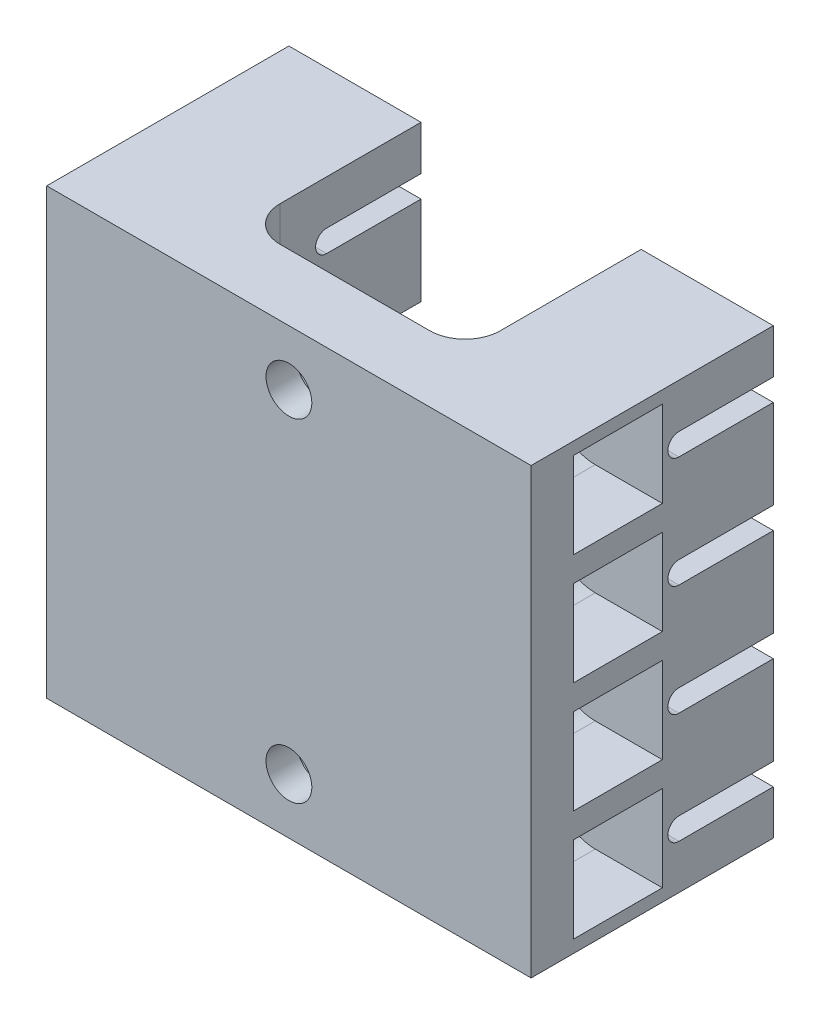
from build123d import *

# Parameters (mm, degrees)
BOSS_EXTRUDE1_START = -4
BOSS_EXTRUDE1_DEPTH = 8
CUT_EXTRUDE1_START  = -8
CUT_EXTRUDE1_DEPTH  = 6.4
CUT_EXTRUDE2_DEPTH  = 22.959710978
FILLET1_R           = 2.54
SKETCH6_R           = 3.25
CUT_EXTRUDE5_DEPTH  = 6.80625
LPATTERN1_COUNT     = 4
LPATTERN1_PITCH     = 8
SKETCH4_R           = 1.651
CUT_EXTRUDE3_DEPTH  = 36.358576134
SKETCH5_R           = 3.175
CUT_EXTRUDE4_DEPTH  = 2.54


# Read off the part's stored shape, not the designer's step: Boss-Extrude1
with BuildPart() as part:
    # Boss-Extrude1 outline → Boss-Extrude1 (new body)
    with BuildSketch(Plane(origin=(0, 0, 0), x_dir=(1, 0, 0), z_dir=(0, 1, 0)).offset(BOSS_EXTRUDE1_START)):
        Polygon((0, -4.7625), (0, 0), (-7.9375, 0), (-7.9375, 12.7), (-17.4625, 12.7), (-17.4625, -4.7625), align=None)
    extrude(amount=BOSS_EXTRUDE1_DEPTH)

    # Sketch2 → Cut-Extrude1 (cut)
    with BuildSketch(Plane(origin=(0, 0, -12.7), x_dir=(-1, 0, 0), z_dir=(0, 0, -1)).offset(CUT_EXTRUDE1_START)):
        with BuildLine():
            Line((17.4625, -3.1), (12.625, -3.1))
            ThreePointArc((12.625, -3.1), (9.525, 0), (12.625, 3.1))
            Line((12.625, 3.1), (17.4625, 3.1))
            ThreePointArc((17.4625, 3.1), (20.5625, 0), (17.4625, -3.1))
        make_face()
    extrude(amount=-CUT_EXTRUDE1_DEPTH, mode=Mode.SUBTRACT)

    # Sketch3 → Cut-Extrude2 (cut, through all)
    with BuildSketch(Plane.ZY.offset(17.4625)):
        with BuildLine():
            Line((-12.7, 0.79375), (-5.89375, 0.79375))
            ThreePointArc((-5.89375, 0.79375), (-5.1, 0), (-5.89375, -0.79375))
            Line((-5.89375, -0.79375), (-12.7, -0.79375))
            ThreePointArc((-12.7, -0.79375), (-13.49375, 0), (-12.7, 0.79375))
        make_face()
    extrude(amount=-CUT_EXTRUDE2_DEPTH, mode=Mode.SUBTRACT)

    # Fillet1
    fillet1_edges = [part.edges().sort_by_distance(p)[0] for p in [
        (-7.9375, 0, 0),
    ]]
    fillet(fillet1_edges, radius=FILLET1_R)

    # Sketch6 → Cut-Extrude5 (cut)
    with BuildSketch(Plane(origin=(0, 0, -12.7), x_dir=(-1, 0, 0), z_dir=(0, 0, -1))):
        with Locations((12.7, 0)):
            Circle(SKETCH6_R)
    extrude(amount=-CUT_EXTRUDE5_DEPTH, mode=Mode.SUBTRACT)

    # Mirror1: part across plane


with BuildPart() as part_1:
    add(part.part)
    add(part.part.mirror(Plane(origin=(0, 4, 0), x_dir=(0, 0, 1), z_dir=(-1, 0, 0))))


with BuildPart() as lpattern1_1:
    # LPattern1: pattern copy
    add(part_1.part.moved(Location(Vector(0, -1, 0) * (1 * LPATTERN1_PITCH))))


with BuildPart() as lpattern1_2:
    # LPattern1: pattern copy
    add(part_1.part.moved(Location(Vector(0, -1, 0) * (2 * LPATTERN1_PITCH))))


with BuildPart() as lpattern1_3:
    # LPattern1: pattern copy
    add(part_1.part.moved(Location(Vector(0, -1, 0) * (3 * LPATTERN1_PITCH))))


with BuildPart() as part_2:
    add(part_1.part)

    # Combine1: union LPattern1_1, LPattern1_2, LPattern1_3
    add(lpattern1_1.part)
    add(lpattern1_2.part)
    add(lpattern1_3.part)

    # Sketch4 → Cut-Extrude3 (cut, through all)
    with BuildSketch(Plane(origin=(0, 0, 0), x_dir=(-1, 0, 0), z_dir=(0, 0, -1))):
        Circle(SKETCH4_R)
        with Locations((0, -24)):
            Circle(SKETCH4_R)
    extrude(amount=-CUT_EXTRUDE3_DEPTH, mode=Mode.SUBTRACT)

    # Sketch5 → Cut-Extrude4 (cut)
    with BuildSketch(Plane(origin=(0, 0, 0), x_dir=(-1, 0, 0), z_dir=(0, 0, -1))):
        Circle(SKETCH5_R)
        with Locations((0, -24)):
            Circle(SKETCH5_R)
    extrude(amount=-CUT_EXTRUDE4_DEPTH, mode=Mode.SUBTRACT)


solid = part_2.part
